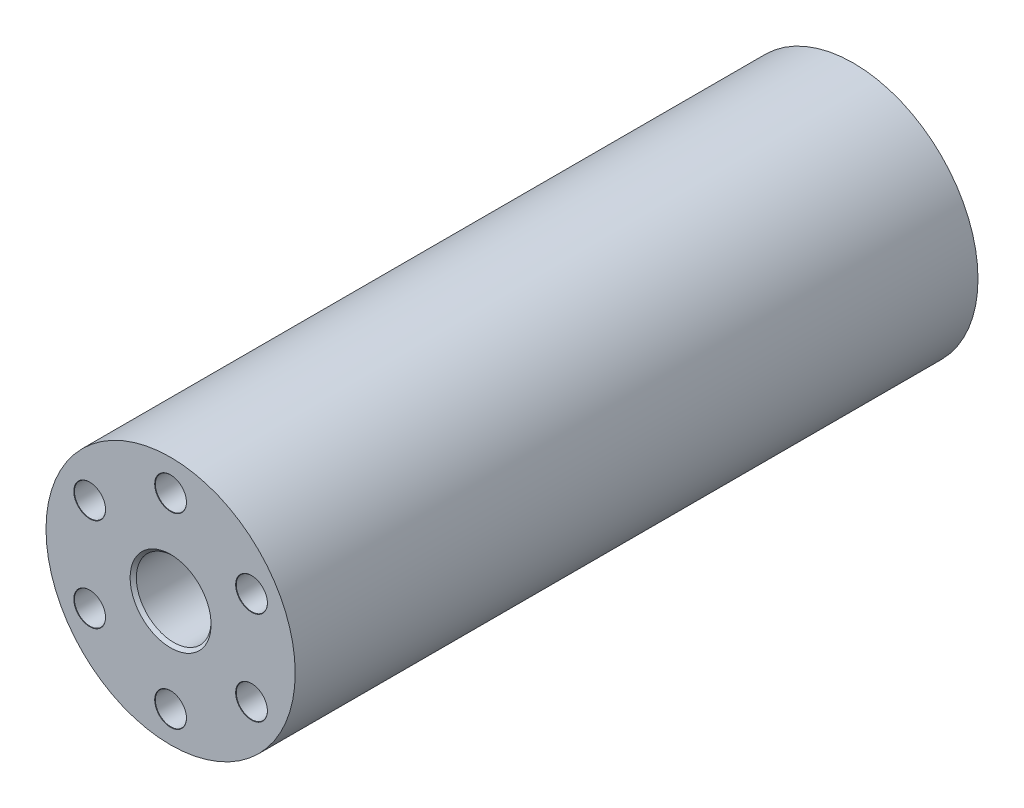
from build123d import *

# Parameters (mm, degrees)
SKETCH1_R                         = 10
BOSS_EXTRUDE1_DEPTH               = 54.8
TAP_DRILL_FOR_M3_TAP1_D           = 2.5
TAP_DRILL_FOR_M3_TAP1_DEPTH       = 10
TAP_DRILL_FOR_M3_TAP1_CSINK_D     = 2.55
TAP_DRILL_FOR_M3_TAP1_CSINK_ANGLE = 90
TAP_DRILL_FOR_M3_TAP1_TIP         = 0.751075774
TAP_DRILL_FOR_M3_TAP2_D           = 2.5
TAP_DRILL_FOR_M3_TAP2_DEPTH       = 10
TAP_DRILL_FOR_M3_TAP2_CSINK_D     = 2.55
TAP_DRILL_FOR_M3_TAP2_CSINK_ANGLE = 90
TAP_DRILL_FOR_M3_TAP2_TIP         = 0.751075774


with BuildPart() as part:
    # Sketch1 → Boss-Extrude1 (new body)
    with BuildSketch(Plane.XY):
        Circle(SKETCH1_R)
    extrude(amount=BOSS_EXTRUDE1_DEPTH)

    # Sketch4 → Ø6.0mm Dowel Hole1 (revolve, cut)
    with BuildSketch(Plane.YZ):
        Polygon((0, 0), (0, 54.8), (3.25, 54.8), (3, 54.55), (3, 0.25), (3.25, 0), align=None)
    revolve(axis=Axis((0, 0, -6.35), (0, 0, 1)), mode=Mode.SUBTRACT)

    # Tap Drill for M3 Tap1
    with Locations(Plane(origin=(0, 0, 0), x_dir=(-1, 0, 0), z_dir=(0, 0, -1))):
        with Locations((-6.062177826, -3.5), (0, 7), (6.062177826, -3.5)):
            CounterSinkHole(TAP_DRILL_FOR_M3_TAP1_D / 2, TAP_DRILL_FOR_M3_TAP1_CSINK_D / 2, depth=TAP_DRILL_FOR_M3_TAP1_DEPTH, counter_sink_angle=TAP_DRILL_FOR_M3_TAP1_CSINK_ANGLE)
            with Locations((0, 0, -(TAP_DRILL_FOR_M3_TAP1_DEPTH + TAP_DRILL_FOR_M3_TAP1_TIP / 2))):  # 118° drill point
                Cone(0, TAP_DRILL_FOR_M3_TAP1_D / 2, TAP_DRILL_FOR_M3_TAP1_TIP, mode=Mode.SUBTRACT)

    # Tap Drill for M3 Tap2
    with Locations(Plane.XY.offset(54.8)):
        with Locations((-6.495190528, 3.75), (0, 7.5), (6.495190528, 3.75), (6.495190528, -3.75), (0, -7.5), (-6.495190528, -3.75)):
            CounterSinkHole(TAP_DRILL_FOR_M3_TAP2_D / 2, TAP_DRILL_FOR_M3_TAP2_CSINK_D / 2, depth=TAP_DRILL_FOR_M3_TAP2_DEPTH, counter_sink_angle=TAP_DRILL_FOR_M3_TAP2_CSINK_ANGLE)
            with Locations((0, 0, -(TAP_DRILL_FOR_M3_TAP2_DEPTH + TAP_DRILL_FOR_M3_TAP2_TIP / 2))):  # 118° drill point
                Cone(0, TAP_DRILL_FOR_M3_TAP2_D / 2, TAP_DRILL_FOR_M3_TAP2_TIP, mode=Mode.SUBTRACT)


solid = part.part
